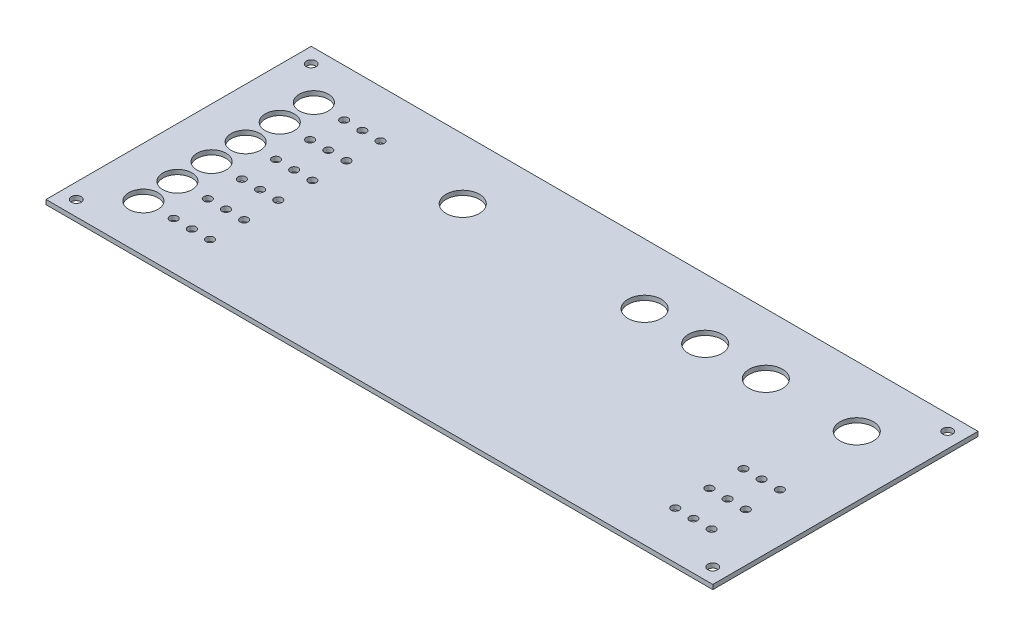
from build123d import *

# Parameters (mm, degrees)
SKETCH1_W           = 440
SKETCH1_H           = 175
SKETCH1_R           = 3.25
SKETCH1_R_2         = 9.6
SKETCH1_R_3         = 2.6
SKETCH1_R_4         = 11
BOSS_EXTRUDE1_DEPTH = 3


with BuildPart() as part:
    # Sketch1 → Boss-Extrude1 (new body)
    with BuildSketch(Plane(origin=(0, 0, 0), x_dir=(1, 0, 0), z_dir=(0, 1, 0))):
        with Locations((220, 87.5)):
            Rectangle(SKETCH1_W, SKETCH1_H)
        with Locations((10, 10)):
            Circle(SKETCH1_R, mode=Mode.SUBTRACT)
        with Locations((10, 165)):
            Circle(SKETCH1_R, mode=Mode.SUBTRACT)
        with Locations((430, 165)):
            Circle(SKETCH1_R, mode=Mode.SUBTRACT)
        with Locations((430, 10)):
            Circle(SKETCH1_R, mode=Mode.SUBTRACT)
        with Locations((33, 31.25)):
            Circle(SKETCH1_R_2, mode=Mode.SUBTRACT)
        with Locations((33, 53.75)):
            Circle(SKETCH1_R_2, mode=Mode.SUBTRACT)
        with Locations((33, 76.25)):
            Circle(SKETCH1_R_2, mode=Mode.SUBTRACT)
        with Locations((33, 98.75)):
            Circle(SKETCH1_R_2, mode=Mode.SUBTRACT)
        with Locations((33, 121.25)):
            Circle(SKETCH1_R_2, mode=Mode.SUBTRACT)
        with Locations((33, 143.75)):
            Circle(SKETCH1_R_2, mode=Mode.SUBTRACT)
        with Locations((53, 31.25)):
            Circle(SKETCH1_R_3, mode=Mode.SUBTRACT)
        with Locations((53, 53.75)):
            Circle(SKETCH1_R_3, mode=Mode.SUBTRACT)
        with Locations((53, 76.25)):
            Circle(SKETCH1_R_3, mode=Mode.SUBTRACT)
        with Locations((53, 98.75)):
            Circle(SKETCH1_R_3, mode=Mode.SUBTRACT)
        with Locations((53, 121.25)):
            Circle(SKETCH1_R_3, mode=Mode.SUBTRACT)
        with Locations((53, 143.75)):
            Circle(SKETCH1_R_3, mode=Mode.SUBTRACT)
        with Locations((65, 31.25)):
            Circle(SKETCH1_R_3, mode=Mode.SUBTRACT)
        with Locations((65, 53.75)):
            Circle(SKETCH1_R_3, mode=Mode.SUBTRACT)
        with Locations((65, 76.25)):
            Circle(SKETCH1_R_3, mode=Mode.SUBTRACT)
        with Locations((65, 98.75)):
            Circle(SKETCH1_R_3, mode=Mode.SUBTRACT)
        with Locations((65, 121.25)):
            Circle(SKETCH1_R_3, mode=Mode.SUBTRACT)
        with Locations((65, 143.75)):
            Circle(SKETCH1_R_3, mode=Mode.SUBTRACT)
        with Locations((77, 31.25)):
            Circle(SKETCH1_R_3, mode=Mode.SUBTRACT)
        with Locations((77, 53.75)):
            Circle(SKETCH1_R_3, mode=Mode.SUBTRACT)
        with Locations((77, 76.25)):
            Circle(SKETCH1_R_3, mode=Mode.SUBTRACT)
        with Locations((77, 98.75)):
            Circle(SKETCH1_R_3, mode=Mode.SUBTRACT)
        with Locations((77, 121.25)):
            Circle(SKETCH1_R_3, mode=Mode.SUBTRACT)
        with Locations((77, 143.75)):
            Circle(SKETCH1_R_3, mode=Mode.SUBTRACT)
        with Locations((400, 135)):
            Circle(SKETCH1_R_4, mode=Mode.SUBTRACT)
        with Locations((340, 135)):
            Circle(SKETCH1_R_4, mode=Mode.SUBTRACT)
        with Locations((300, 135)):
            Circle(SKETCH1_R_4, mode=Mode.SUBTRACT)
        with Locations((260, 135)):
            Circle(SKETCH1_R_4, mode=Mode.SUBTRACT)
        with Locations((140, 135)):
            Circle(SKETCH1_R_4, mode=Mode.SUBTRACT)
        with Locations((408, 31.25)):
            Circle(SKETCH1_R_3, mode=Mode.SUBTRACT)
        with Locations((396, 31.25)):
            Circle(SKETCH1_R_3, mode=Mode.SUBTRACT)
        with Locations((384, 31.25)):
            Circle(SKETCH1_R_3, mode=Mode.SUBTRACT)
        with Locations((408, 53.75)):
            Circle(SKETCH1_R_3, mode=Mode.SUBTRACT)
        with Locations((396, 53.75)):
            Circle(SKETCH1_R_3, mode=Mode.SUBTRACT)
        with Locations((384, 53.75)):
            Circle(SKETCH1_R_3, mode=Mode.SUBTRACT)
        with Locations((408, 76.25)):
            Circle(SKETCH1_R_3, mode=Mode.SUBTRACT)
        with Locations((396, 76.25)):
            Circle(SKETCH1_R_3, mode=Mode.SUBTRACT)
        with Locations((384, 76.25)):
            Circle(SKETCH1_R_3, mode=Mode.SUBTRACT)
    extrude(amount=BOSS_EXTRUDE1_DEPTH)


solid = part.part
